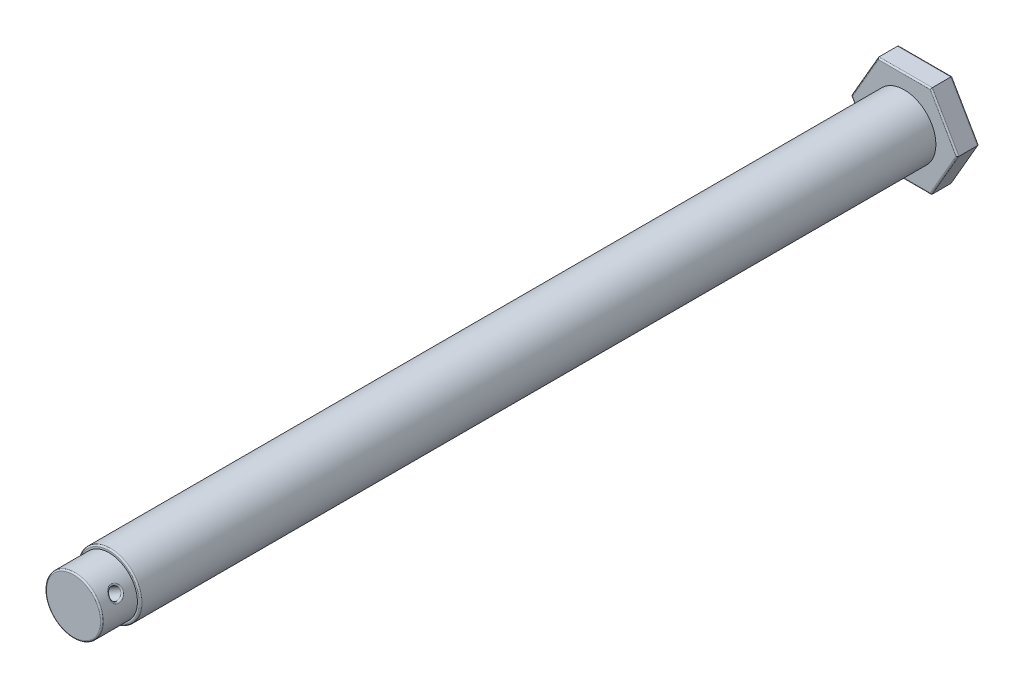
from build123d import *

# Parameters (mm, degrees)
EXTRUDE_1_DEPTH     = 15
SKETCH_2_R          = 22.25
EXTRUDE_2_DEPTH     = 560
SKETCH_3_R          = 20
EXTRUDE_3_DEPTH     = 25
SKETCH_4_R          = 4
CUT_EXTRUDE_4_DEPTH = 606.548993339
FILLET_1_R          = 1


with BuildPart() as part:
    # 草图1 → 拉伸1 (new body)
    with BuildSketch(Plane.XY):
        Polygon((37.527767497, 0), (18.763883749, 32.5), (-18.763883749, 32.5), (-37.527767497, 0), (-18.763883749, -32.5), (18.763883749, -32.5), align=None)
    extrude(amount=EXTRUDE_1_DEPTH)

    # 草图2 → 拉伸2 (add)
    with BuildSketch(Plane.XY.offset(15)):
        Circle(SKETCH_2_R)
    extrude(amount=EXTRUDE_2_DEPTH)

    # 草图3 → 拉伸3 (add)
    with BuildSketch(Plane.XY.offset(575)):
        Circle(SKETCH_3_R)
    extrude(amount=EXTRUDE_3_DEPTH)

    # 草图4 → 拉伸4 (cut, through all)
    with BuildSketch(Plane(origin=(-28.145825623, -16.25, 0), x_dir=(0, 0, 1), z_dir=(-0.8660254037844388, -0.4999999999999997, 0))):
        with Locations((587.5, 0)):
            Circle(SKETCH_4_R)
    extrude(amount=-CUT_EXTRUDE_4_DEPTH, mode=Mode.SUBTRACT)

    # 圆角1
    fillet_1_edges = [part.edges().sort_by_distance(p)[0] for p in [
        (28.145825623, 16.25, 0),
        (0, 32.5, 0),
        (-28.145825623, 16.25, 0),
        (-28.145825623, -16.25, 0),
        (0, -32.5, 0),
        (28.145825623, -16.25, 0),
        (17.320508075, 10, 583.499999999),
        (-17.320508075, -9.999999999, 583.499999999),
        (-28.145825623, -16.25, 15),
        (0, -32.5, 15),
        (28.145825623, -16.25, 15),
        (28.145825623, 16.25, 15),
        (-28.145825623, 16.25, 15),
        (0, 32.5, 15),
        (-22.25, 0, 575),
        (-20, 0, 600),
    ]]
    fillet(fillet_1_edges, radius=FILLET_1_R)


solid = part.part
